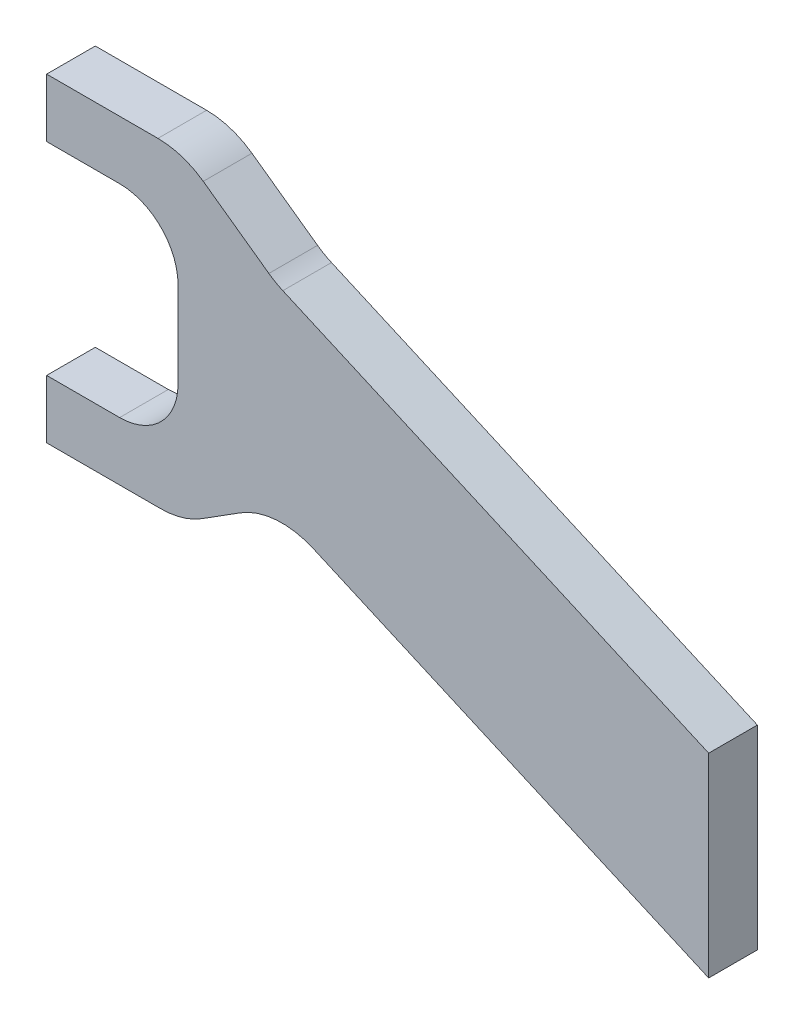
from build123d import *

# Parameters (mm, degrees)
BOSS_EXTRUDE1_DEPTH = 0.125
FILLET1_R           = 0.3
FILLET2_R           = 0.4


with BuildPart() as part:
    # frame_outline → Boss-Extrude1 (new, symmetric)
    with BuildSketch(Plane.XY):
        Polygon((0, 1.64), (0, 1.34), (0.675, 1.34), (0.675, 0.3), (0, 0.3), (0, 0), (0.7, 0), (1.175, 0.3), (3.4, -0.68), (3.4, 0.32), (1.175, 1.3), (0.7, 1.64), align=None)
    extrude(amount=BOSS_EXTRUDE1_DEPTH, both=True)

    # Fillet1
    fillet1_edges = [part.edges().sort_by_distance(p)[0] for p in [
        (0.675, 0.3, 0),
        (0.675, 1.34, 0),
    ]]
    fillet(fillet1_edges, radius=FILLET1_R)

    # Fillet2
    fillet2_edges = [part.edges().sort_by_distance(p)[0] for p in [
        (0.7, 0, 0),
        (1.175, 0.3, 0),
        (1.175, 1.3, 0),
        (0.7, 1.64, 0),
    ]]
    fillet(fillet2_edges, radius=FILLET2_R)


solid = part.part
